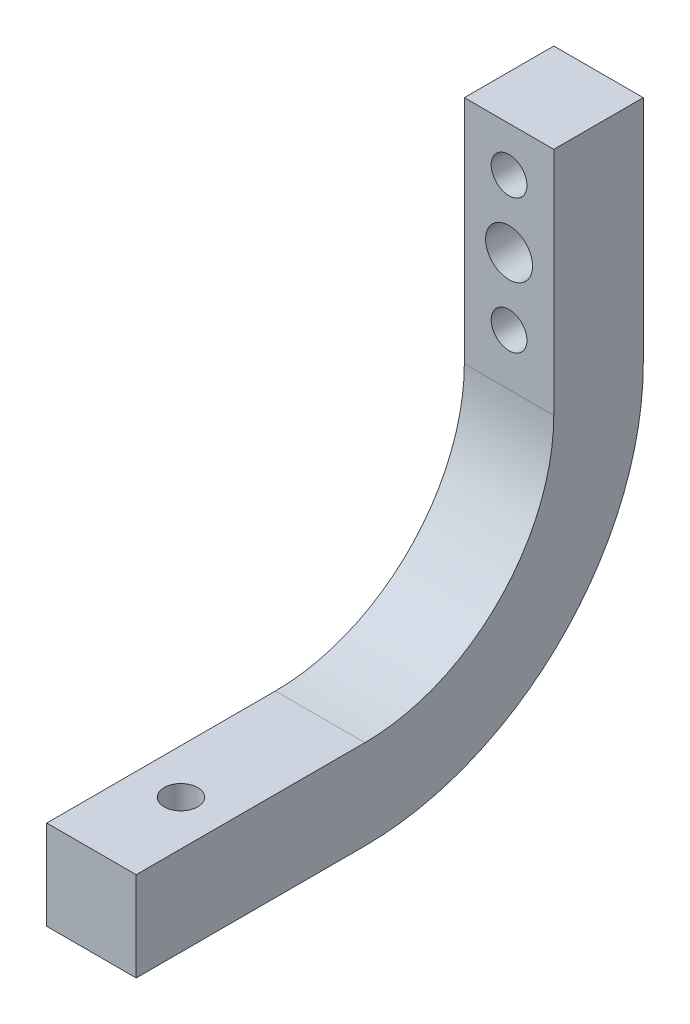
from build123d import *

# Parameters (mm, degrees)
BOSS_EXTRUDE1_DEPTH      = 4
BOSS_EXTRUDE1_DEPTH_BACK = 4
SKETCH3_R                = 1.5
CUT_EXTRUDE1_DEPTH       = 59.974279139
CUT_EXTRUDE2_DEPTH       = 52.677128403
CUT_EXTRUDE2_DEPTH_BACK  = 52.677128403
SKETCH4_R                = 2.1
SKETCH4_R_2              = 1.6


with BuildPart() as part:
    # Sketch1 → Boss-Extrude1 (new, two sides: drawn at the far end of the back side and taken through both)
    with BuildSketch(Plane(origin=(0, 0, 0), x_dir=(0, 0, -1), z_dir=(1, 0, 0)).offset(-BOSS_EXTRUDE1_DEPTH_BACK)):
        with BuildLine():
            Line((-8, 10), (0, 10))
            Line((0, 10), (0, -10.606666667))
            ThreePointArc((0, -10.606666667), (-7.291088527, -28.208911473), (-24.893333333, -35.5))
            Line((-24.893333333, -35.5), (-37.34, -35.5))
            Line((-37.34, -35.5), (-45.34, -35.5))
            Line((-45.34, -35.5), (-45.34, -27.5))
            Line((-45.34, -27.5), (-37.34, -27.5))
            Line((-37.34, -27.5), (-24.893333333, -27.5))
            ThreePointArc((-24.893333333, -27.5), (-12.947942776, -22.552057224), (-8, -10.606666667))
            Line((-8, -10.606666667), (-8, 10))
        make_face()
    extrude(amount=BOSS_EXTRUDE1_DEPTH + BOSS_EXTRUDE1_DEPTH_BACK)

    # Sketch3 → Cut-Extrude1 (cut, through all)
    with BuildSketch(Plane(origin=(0, -27.5, 0), x_dir=(1, 0, 0), z_dir=(0, 1, 0))):
        with Locations((0, -37.34)):
            Circle(SKETCH3_R)
    extrude(amount=-CUT_EXTRUDE1_DEPTH, mode=Mode.SUBTRACT)

    # Sketch4 → Cut-Extrude2 (cut, two sides: drawn at the far end of the back side and taken through both)
    with BuildSketch(Plane.XY.offset(8).offset(-CUT_EXTRUDE2_DEPTH_BACK)):
        Circle(SKETCH4_R)
        with Locations((0, 6)):
            Circle(SKETCH4_R_2)
        with Locations((0, -6)):
            Circle(SKETCH4_R_2)
    extrude(amount=CUT_EXTRUDE2_DEPTH + CUT_EXTRUDE2_DEPTH_BACK, mode=Mode.SUBTRACT)


solid = part.part
